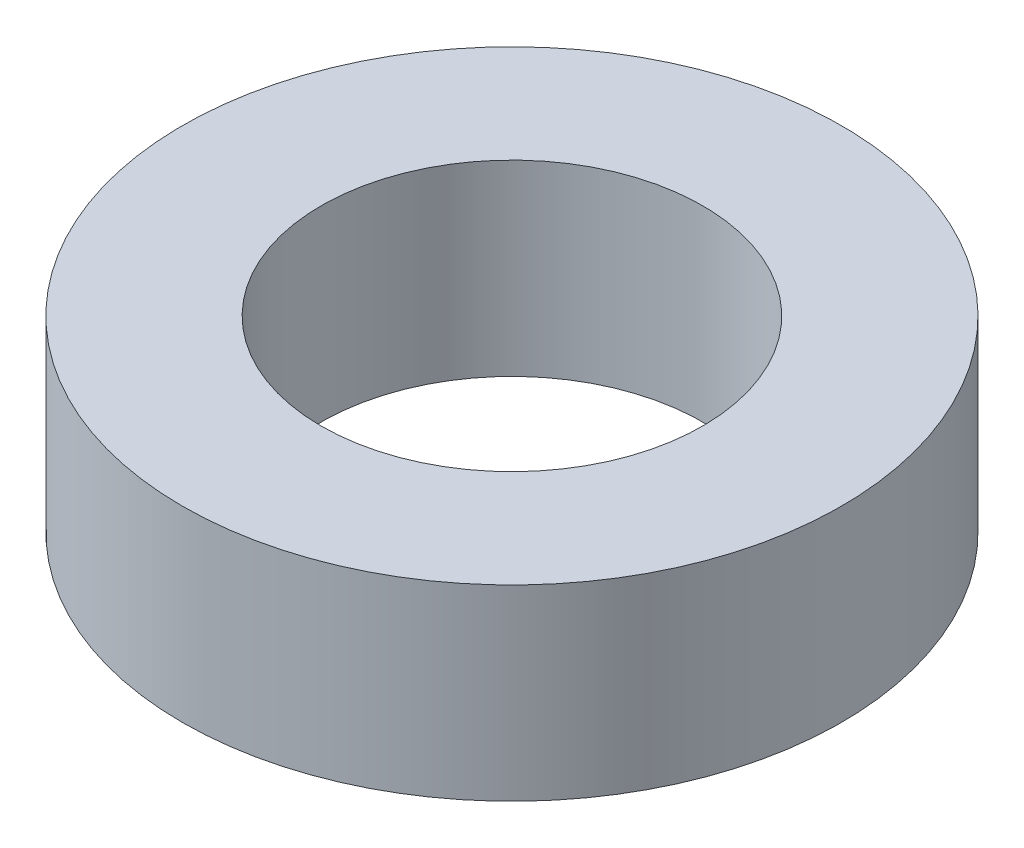
from build123d import *

# Parameters (mm, degrees)
SKETCH1_R           = 47.5
BOSS_EXTRUDE1_DEPTH = 27
SKETCH2_R           = 27.5
CUT_EXTRUDE1_DEPTH  = 73.398204398


with BuildPart() as part:
    # Sketch1 → Boss-Extrude1 (new body)
    with BuildSketch(Plane(origin=(0, 0, 0), x_dir=(1, 0, 0), z_dir=(0, 1, 0))):
        Circle(SKETCH1_R)
    extrude(amount=BOSS_EXTRUDE1_DEPTH)

    # Sketch2 → Cut-Extrude1 (cut, through all)
    with BuildSketch(Plane(origin=(0, 0, 0), x_dir=(1, 0, 0), z_dir=(0, 1, 0))):
        Circle(SKETCH2_R)
    extrude(amount=CUT_EXTRUDE1_DEPTH, mode=Mode.SUBTRACT)


solid = part.part
